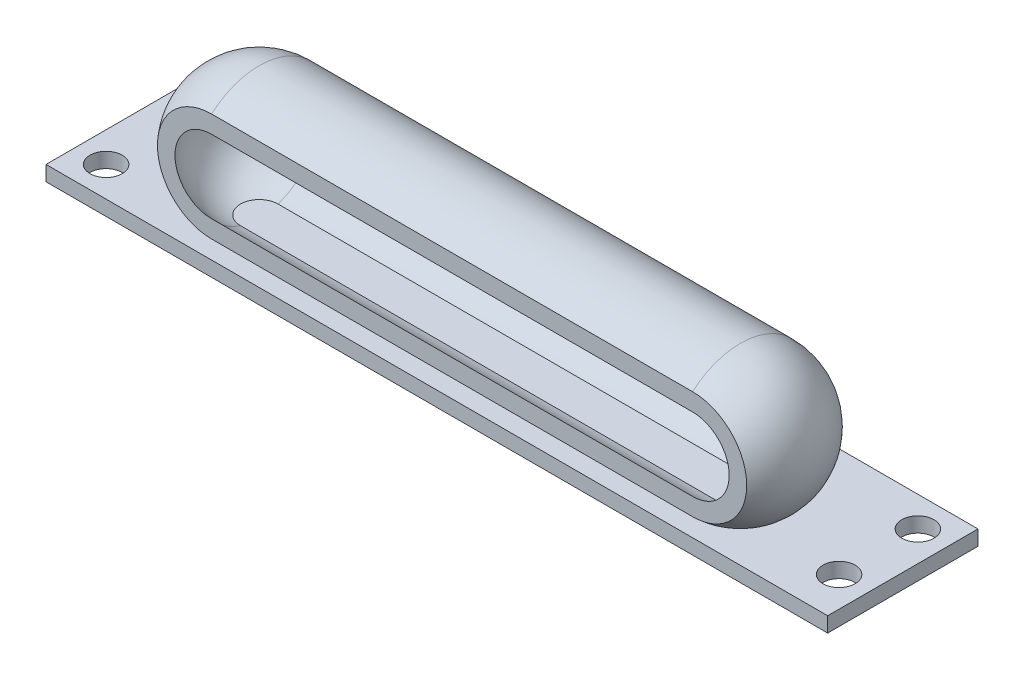
from build123d import *

# Parameters (mm, degrees)
SKETCH2_W            = 5.08
SKETCH2_H            = 11.43
CUT_EXTRUDE1_DEPTH   = 76.2
SKETCH3_W            = 82.55
SKETCH3_H            = 15.875
BOSS_EXTRUDE1_DEPTH  = 1.5875
M3_CLEARANCE_HOLE1_D = 3.4


# Read off the part's stored shape, not the designer's step: Shell1
with BuildPart() as part:
    # Sketch1 → Revolve1 (revolve)
    with BuildSketch(Plane.XY):
        with BuildLine():
            Line((0, 7.62), (50.8, 7.62))
            ThreePointArc((50.8, 7.62), (56.188153673, 5.388153673), (58.42, 0))
            Line((58.42, 0), (-7.62, 0))
            ThreePointArc((-7.62, 0), (-5.388153673, 5.388153673), (0, 7.62))
        make_face()
    revolve(axis=Axis((0, 0, 0), (1, 0, 0)))

    # Sketch2 → Cut-Extrude1 (cut, symmetric)
    with BuildSketch(Plane(origin=(0, 0, 0), x_dir=(0, 0, -1), z_dir=(1, 0, 0))):
        with Locations((-7.580156248, 0)):
            Rectangle(SKETCH2_W, SKETCH2_H)
    extrude(amount=CUT_EXTRUDE1_DEPTH, both=True, mode=Mode.SUBTRACT)

    # Shell1 outline → Shell1 (revolve, cut)
    with BuildSketch(Plane.YX):
        with BuildLine():
            Line((0, 57.15), (0, -6.35))
            ThreePointArc((0, -6.35), (4.490128063, -4.490128058), (6.35, 6e-09))
            Line((6.35, 6e-09), (6.35, 50.799999994))
            ThreePointArc((6.35, 50.799999994), (4.490128063, 55.290128058), (0, 57.15))
        make_face()
    revolve(axis=Axis((0, 0, 0), (1, 0, 0)), mode=Mode.SUBTRACT)

    # Sketch3 → Boss-Extrude1 (add)
    with BuildSketch(Plane(origin=(0, -7.62, 0), x_dir=(1, 0, 0), z_dir=(0, 1, 0))):
        with Locations((25.4, 1.289921876)):
            Rectangle(SKETCH3_W, SKETCH3_H)
    extrude(amount=BOSS_EXTRUDE1_DEPTH)

    # M3 Clearance Hole1 (through all)
    with Locations(Plane(origin=(0, -6.0325, 0), x_dir=(1, 0, 0), z_dir=(0, 1, 0))):
        with Locations((-12.7, 6.052421876), (-12.7, -3.472578124), (63.5, 6.052421876), (63.5, -2.26916829)):
            Hole(M3_CLEARANCE_HOLE1_D / 2)


solid = part.part
